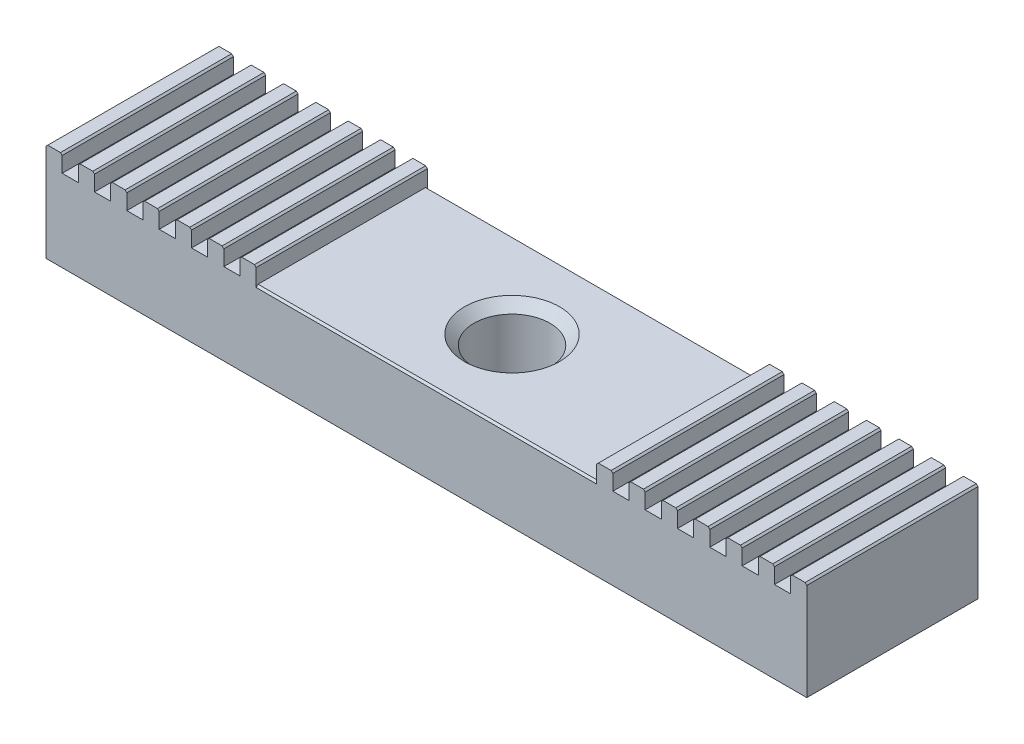
from build123d import *

# Parameters (mm, degrees)
SKETCH_1_W                          = 40
SKETCH_1_H                          = 9
EXTRUDE_1_DEPTH                     = 4.3
SKETCH_2_W                          = 0.85
SKETCH_2_H                          = 0.9
EXTRUDE_2_DEPTH                     = 9
CHAMFER_1_SIZE                      = 0.09
PATTERN_LINEAR_10_COUNT             = 7
PATTERN_LINEAR_10_PITCH             = 1.7
CHAMFER_1_OF_PATTERN_LINEAR_10_SIZE = 0.09
MIRROR_START                        = -4.5
MIRROR_3_DEPTH                      = 9
SKETCH_4_R                          = 2
CUT_EXTRUDE_1_DEPTH                 = 21.946121359
CHAMFER_2_SIZE                      = 0.5
CHAMFER_3_SIZE                      = 0.1


# Read off the part's stored shape, not the designer's step: 鏡射3
with BuildPart() as part:
    # 草圖1 → 填料-伸長1 (new body)
    with BuildSketch(Plane(origin=(0, 0, 0), x_dir=(1, 0, 0), z_dir=(0, 1, 0))):
        Rectangle(SKETCH_1_W, SKETCH_1_H)
    extrude(amount=EXTRUDE_1_DEPTH)

    # 草圖2 → 填料-伸長2 (add)
    with BuildSketch(Plane.XY.offset(4.5)):
        with Locations((-19.575, 4.75)):
            Rectangle(SKETCH_2_W, SKETCH_2_H)
    extrude_2 = extrude(amount=-EXTRUDE_2_DEPTH)

    # 導角1
    chamfer_1_edges = [part.edges().sort_by_distance(p)[0] for p in [
        (-20, 5.2, 0),
        (-19.15, 5.2, 0),
    ]]
    chamfer(chamfer_1_edges, length=CHAMFER_1_SIZE)

    # 直線複製排列10: 填料-伸長2 ×7
    with Locations(*[(i * PATTERN_LINEAR_10_PITCH, 0, 0) for i in range(1, PATTERN_LINEAR_10_COUNT)]):
        add(extrude_2)

    # 導角1 of 直線複製排列10
    chamfer_1_of_pattern_linear_10_edges = [part.edges().sort_by_distance(p)[0] for p in [
        (-18.3, 5.2, 0),
        (-17.45, 5.2, 0),
        (-16.6, 5.2, 0),
        (-15.75, 5.2, 0),
        (-14.9, 5.2, 0),
        (-14.05, 5.2, 0),
        (-13.2, 5.2, 0),
        (-12.35, 5.2, 0),
        (-11.5, 5.2, 0),
        (-10.65, 5.2, 0),
        (-9.8, 5.2, 0),
        (-8.95, 5.2, 0),
    ]]
    chamfer(chamfer_1_of_pattern_linear_10_edges, length=CHAMFER_1_OF_PATTERN_LINEAR_10_SIZE)

    # 鏡射3 outline → 鏡射3 (add)
    with BuildSketch(Plane.XY.offset(MIRROR_START)):
        Polygon((8.95, 4.3), (9.8, 4.3), (9.8, 5.11), (9.71, 5.2), (9.04, 5.2), (8.95, 5.11), align=None)
        Polygon((10.65, 4.3), (11.5, 4.3), (11.5, 5.11), (11.41, 5.2), (10.74, 5.2), (10.65, 5.11), align=None)
        Polygon((12.35, 4.3), (13.2, 4.3), (13.2, 5.11), (13.11, 5.2), (12.44, 5.2), (12.35, 5.11), align=None)
        Polygon((14.05, 4.3), (14.9, 4.3), (14.9, 5.11), (14.81, 5.2), (14.14, 5.2), (14.05, 5.11), align=None)
        Polygon((15.75, 4.3), (16.6, 4.3), (16.6, 5.11), (16.51, 5.2), (15.84, 5.2), (15.75, 5.11), align=None)
        Polygon((17.45, 4.3), (18.3, 4.3), (18.3, 5.11), (18.21, 5.2), (17.54, 5.2), (17.45, 5.11), align=None)
        Polygon((20, 4.3), (20, 5.11), (19.91, 5.2), (19.24, 5.2), (19.15, 5.11), (19.15, 4.3), align=None)
    extrude(amount=MIRROR_3_DEPTH)

    # 草圖4 → 除料-伸長1 (cut, through all)
    with BuildSketch(Plane(origin=(0, 4.3, 0), x_dir=(1, 0, 0), z_dir=(0, 1, 0))):
        with Locations(Location((0, 0, 0), (0, 0, 270))):
            Circle(SKETCH_4_R)
    extrude(amount=-CUT_EXTRUDE_1_DEPTH, mode=Mode.SUBTRACT)

    # 導角2
    chamfer_2_edges = [part.edges().sort_by_distance(p)[0] for p in [
        (0, 4.3, -2),
    ]]
    chamfer(chamfer_2_edges, length=CHAMFER_2_SIZE)

    # 導角3
    chamfer_3_edges = [part.edges().sort_by_distance(p)[0] for p in [
        (0, 4.3, -4.5),
        (0, 4.3, 4.5),
    ]]
    chamfer(chamfer_3_edges, length=CHAMFER_3_SIZE)


solid = part.part
